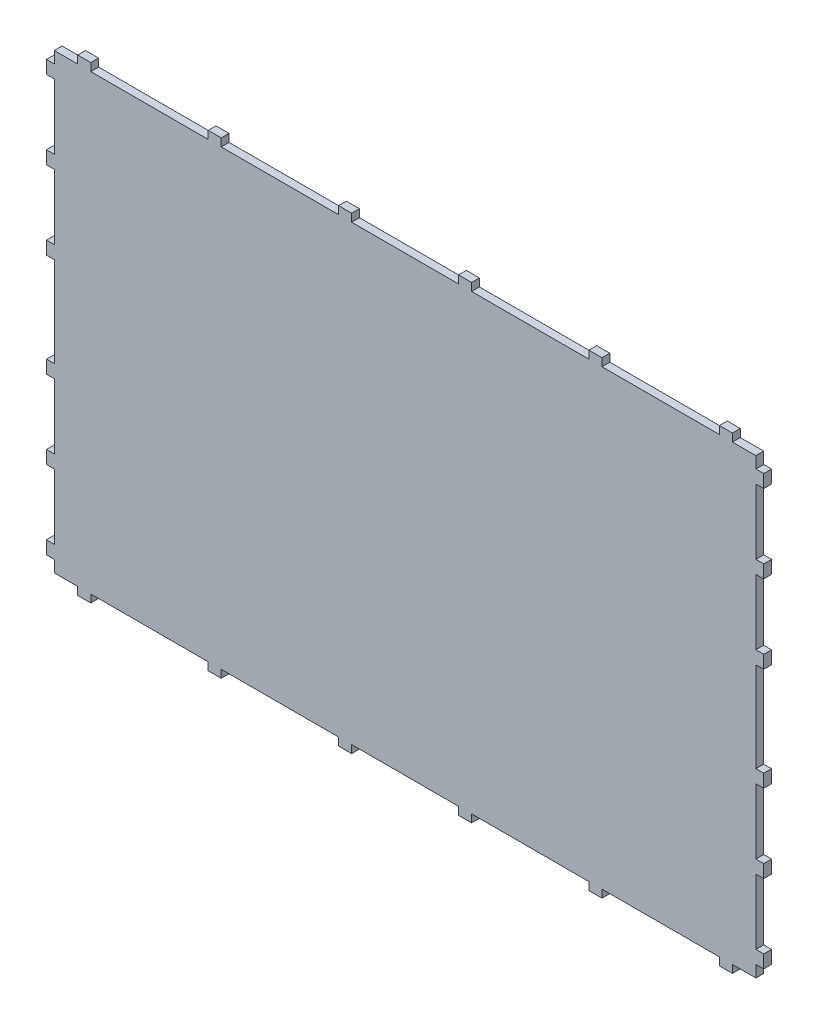
from build123d import *

# Parameters (mm, degrees)
EXTRUDE_1_DEPTH = 6


with BuildPart() as part:
    # Эскиз1 → Бобышка-Вытянуть1 (new body)
    with BuildSketch(Plane.XY):
        Polygon((-367.472703646, 191.929785592), (-349.472703646, 191.929785592), (-349.472703646, 197.929785592), (-339.472703646, 197.929785592), (-339.472703646, 191.929785592), (-249.472703646, 191.929785592), (-249.472703646, 197.929785592), (-239.472703646, 197.929785592), (-239.472703646, 191.929785592), (-149.472703646, 191.929785592), (-149.472703646, 197.929785592), (-139.472703646, 197.929785592), (-139.472703646, 191.929785592), (-57.472703646, 191.929785592), (-57.472703646, 197.929785592), (-47.472703646, 197.929785592), (-47.472703646, 191.929785592), (42.527296354, 191.929785592), (42.527296354, 197.929785592), (52.527296354, 197.929785592), (52.527296354, 191.929785592), (142.527296354, 191.929785592), (142.527296354, 197.929785592), (152.527296354, 197.929785592), (152.527296354, 191.929785592), (170.527296353, 191.929785592), (170.527296353, 183.029785592), (176.527296353, 183.029785592), (176.527296353, 173.029785592), (170.527296353, 173.029785592), (170.527296353, 123.029785592), (176.527296353, 123.029785592), (176.527296353, 113.029785592), (170.527296353, 113.029785592), (170.527296353, 63.029785592), (176.527296353, 63.029785592), (176.527296353, 53.029785592), (170.527296353, 53.029785592), (170.527296353, -15.970214408), (176.527296353, -15.970214408), (176.527296353, -25.970214408), (170.527296353, -25.970214408), (170.527296353, -75.970214408), (176.527296353, -75.970214408), (176.527296353, -85.970214408), (170.527296353, -85.970214408), (170.527296353, -135.970214408), (176.527296353, -135.970214408), (176.527296353, -145.970214408), (170.527296353, -145.970214408), (170.527296353, -154.970214408), (152.527296354, -154.970214408), (152.527296354, -160.970214408), (142.527296354, -160.970214408), (142.527296354, -154.970214408), (52.527296354, -154.970214408), (52.527296354, -160.970214408), (42.527296354, -160.970214408), (42.527296354, -154.970214408), (-47.472703646, -154.970214408), (-47.472703646, -160.970214408), (-57.472703646, -160.970214408), (-57.472703646, -154.970214408), (-139.472703646, -154.970214408), (-139.472703646, -160.970214408), (-149.472703646, -160.970214408), (-149.472703646, -154.970214408), (-239.472703646, -154.970214408), (-239.472703646, -160.970214408), (-249.472703646, -160.970214408), (-249.472703646, -154.970214408), (-339.472703646, -154.970214408), (-339.472703646, -160.970214408), (-349.472703646, -160.970214408), (-349.472703646, -154.970214408), (-367.472703646, -154.970214408), (-367.472703646, -145.970214408), (-373.472703646, -145.970214408), (-373.472703646, -135.970214408), (-367.472703646, -135.970214408), (-367.472703646, -85.970214408), (-373.472703646, -85.970214408), (-373.472703646, -75.970214408), (-367.472703646, -75.970214408), (-367.472703646, -25.970214408), (-373.472703646, -25.970214408), (-373.472703646, -15.970214408), (-367.472703646, -15.970214408), (-367.472703646, 53.029785592), (-373.472703646, 53.029785592), (-373.472703646, 63.029785592), (-367.472703646, 63.029785592), (-367.472703646, 113.029785592), (-373.472703646, 113.029785592), (-373.472703646, 123.029785592), (-367.472703646, 123.029785592), (-367.472703646, 173.029785592), (-373.472703646, 173.029785592), (-373.472703646, 183.029785592), (-367.472703646, 183.029785592), align=None)
    extrude(amount=EXTRUDE_1_DEPTH)


solid = part.part
